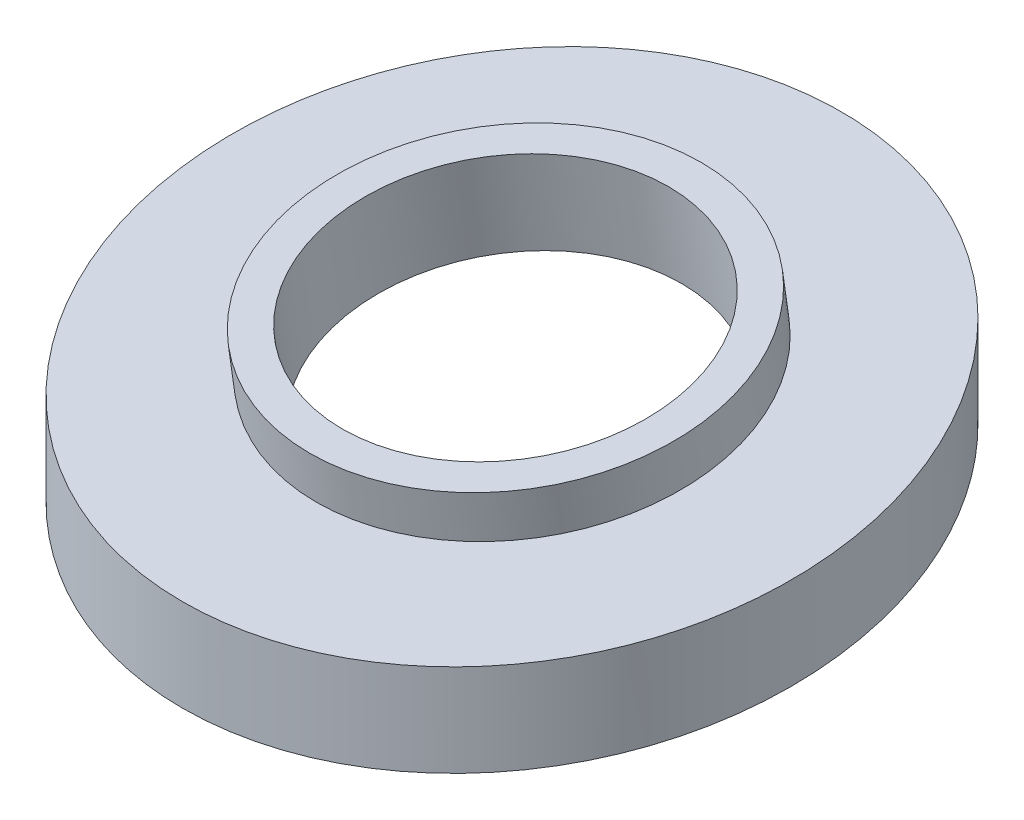
from build123d import *

# Parameters (mm, degrees)
SKETCH_1_R          = 25
EXTRUDE_1_DEPTH     = 30
CUT_EXTRUDE_1_DEPTH = 31.5
SKETCH_10_R         = 15
EXTRUDE_2_DEPTH     = 3.5
SKETCH_11_R         = 21
CUT_EXTRUDE_8_DEPTH = 3.5
SKETCH_12_R         = 12.5
CUT_EXTRUDE_9_DEPTH = 23.5


with BuildPart() as part:
    # 草图1 → 凸台-拉伸1 (new body)
    with BuildSketch(Plane(origin=(0, 0, 0), x_dir=(1, 0, 0), z_dir=(0, 1, 0))):
        Circle(SKETCH_1_R)
    extrude(amount=EXTRUDE_1_DEPTH)

    # 草图3 → 切除-拉伸1 (cut, symmetric)
    with BuildSketch(Plane(origin=(0, 0, 0), x_dir=(0, 0, -1), z_dir=(1, 0, 0))):
        Polygon((-25, 7), (25, 14.188898505), (25, 39.510034579), (-25, 39.510034579), align=None)
        Polygon((-25, 0), (25, 7.188898505), (25, -11.572478834), (-25, -11.572478834), align=None)
    extrude(amount=CUT_EXTRUDE_1_DEPTH, both=True, mode=Mode.SUBTRACT)

    # 草图10 → 凸台-拉伸2 (add)
    with BuildSketch(Plane(origin=(0, 10.379875382, 1.492397412), x_dir=(1, 0, 0), z_dir=(0, 0.9898214870420191, 0.14231452417067592))):
        with Locations((0, 1.507744004)):
            Circle(SKETCH_10_R)
    extrude(amount=EXTRUDE_2_DEPTH)

    # 草图11 → 切除-拉伸8 (cut)
    with BuildSketch(Plane(origin=(0, 3.521649349, 0.506335595), x_dir=(1, 0, 0), z_dir=(0, -0.9898214870420192, -0.14231452417067594))):
        with Locations((0, -1.507744004)):
            Circle(SKETCH_11_R)
    extrude(amount=-CUT_EXTRUDE_8_DEPTH, mode=Mode.SUBTRACT)

    # 草图12 → 切除-拉伸9 (cut)
    with BuildSketch(Plane(origin=(0, 13.844250587, 1.990498247), x_dir=(1, 0, 0), z_dir=(0, 0.9898214870420192, 0.14231452417067594))):
        with Locations((0, 1.507744004)):
            Circle(SKETCH_12_R)
    extrude(amount=-CUT_EXTRUDE_9_DEPTH, mode=Mode.SUBTRACT)


solid = part.part
